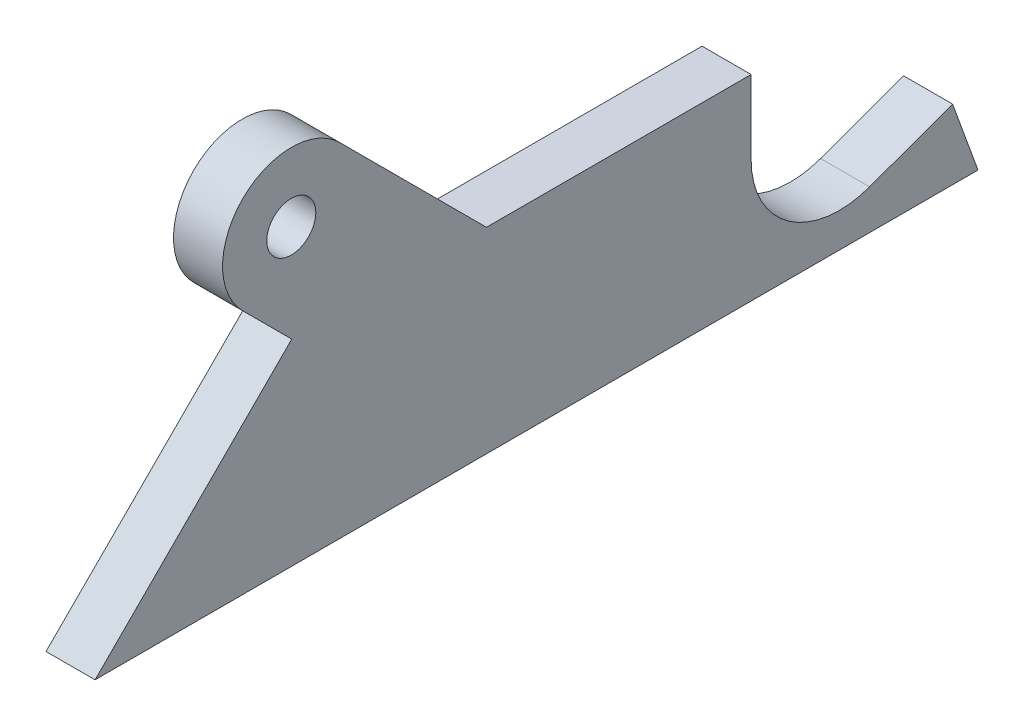
from build123d import *

# Parameters (mm, degrees)
SKETCH1_R           = 6.35
BOSS_EXTRUDE1_DEPTH = 12.7


with BuildPart() as part:
    # Sketch1 → Boss-Extrude1 (new body)
    with BuildSketch(Plane(origin=(0, 0, 0), x_dir=(0, 0, -1), z_dir=(1, 0, 0))):
        with BuildLine():
            Line((-114.3, 0), (114.3, 0))
            Line((114.3, 0), (107.716794971, 18.087207165))
            Line((107.716794971, 18.087207165), (86.23542166, 10.268626689))
            ThreePointArc((86.23542166, 10.268626689), (65.304883848, 13.024184268), (55.556841183, 31.75))
            Line((55.556841183, 31.75), (55.556841183, 50.8))
            Line((55.556841183, 50.8), (-12.955282861, 50.8))
            Line((-12.955282861, 50.8), (-50.927641431, 88.772358569))
            ThreePointArc((-50.927641431, 88.772358569), (-76.072358569, 88.772358569), (-76.072358569, 63.627641431))
            Line((-76.072358569, 63.627641431), (-63.372358569, 50.927641431))
            Line((-63.372358569, 50.927641431), (-114.3, 0))
        make_face()
        with Locations((-63.5, 76.2)):
            Circle(SKETCH1_R, mode=Mode.SUBTRACT)
    extrude(amount=BOSS_EXTRUDE1_DEPTH)


solid = part.part
